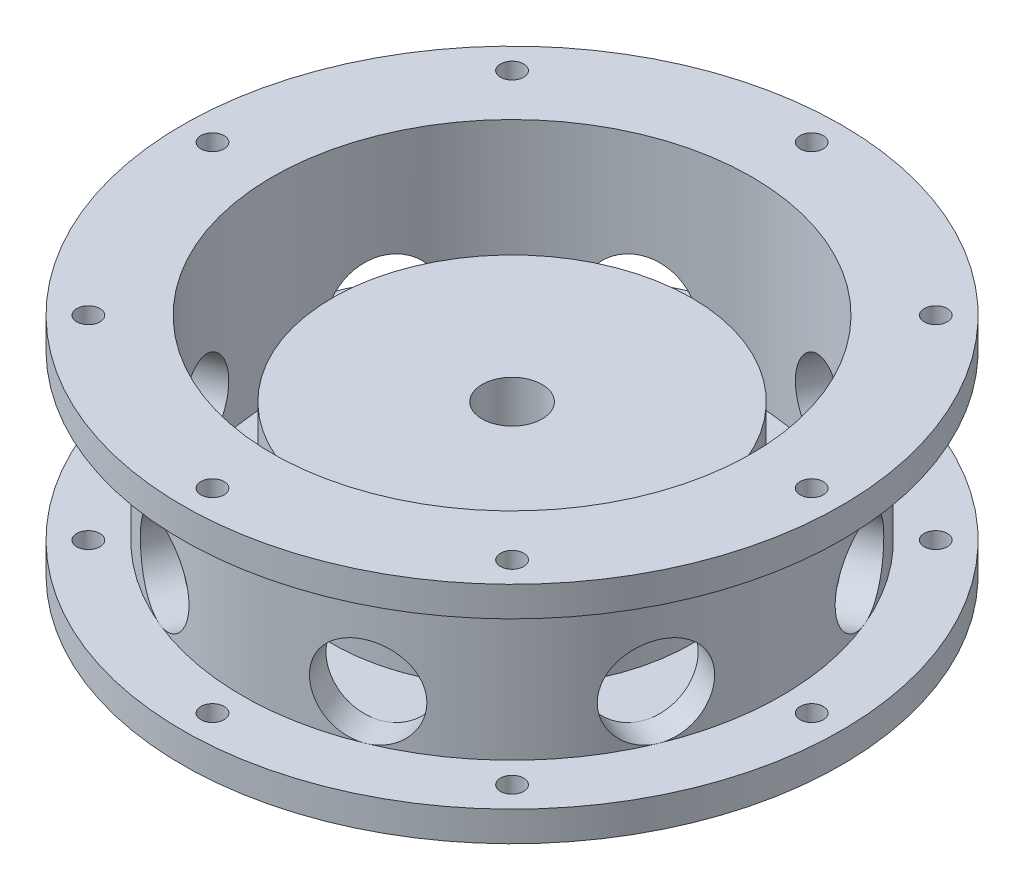
from build123d import *

# Parameters (mm, degrees)
F_10_0_1935_DIAMETER_HOLE2_D = 4.9149
CIRPATTERN1_COUNT            = 8
CUT_EXTRUDE1_REACH           = 162.386
SKETCH5_R                    = 9.525
CIRPATTERN2_COUNT            = 8


with BuildPart() as part:
    # Sketch1 → Revolve1 (revolve)
    with BuildSketch(Plane.XY):
        Polygon((69.85, 0), (6.35, 0), (6.35, 31.75), (38.1, 31.75), (38.1, 6.35), (50.8, 6.35), (50.8, 47.625), (69.85, 47.625), (69.85, 41.275), (57.15, 41.275), (57.15, 6.35), (69.85, 6.35), align=None)
    revolve(axis=Axis((0, 0, 0), (0, 1, 0)))

    # #10 (0.1935) Diameter Hole2 (through all)
    with Locations(Plane(origin=(0, 47.625, 0), x_dir=(1, 0, 0), z_dir=(0, 1, 0))):
        with Locations((0, 63.5)):
            f_10_0_1935_diameter_hole2 = Hole(F_10_0_1935_DIAMETER_HOLE2_D / 2)

    # CirPattern1: #10 (0.1935) Diameter Hole2 ×8 about axis
    cirpattern1_axis = Axis((0, 0, 0), (0, -1, 0))
    for i in range(1, CIRPATTERN1_COUNT):
        add(f_10_0_1935_diameter_hole2.rotate(cirpattern1_axis, i * 360 / CIRPATTERN1_COUNT), mode=Mode.SUBTRACT)

    # Sketch5 → Cut-Extrude1 (cut, up to next)
    with BuildSketch(Plane(origin=(21.87035816, 0, -52.799715283), x_dir=(0, -1, 0), z_dir=(0.3826834323650906, 0, -0.9238795325112865)), mode=Mode.PRIVATE) as cut_extrude1_sk1:
        with Locations((-15.875, 0)):
            Circle(SKETCH5_R)
    cut_extrude1_tool1 = extrude(cut_extrude1_sk1.sketch, amount=-CUT_EXTRUDE1_REACH, mode=Mode.PRIVATE) & part.part
    cut_extrude1 = cut_extrude1_tool1.solids().sort_by_distance((21.870358, 15.875, -52.799715))[0]
    add(cut_extrude1, mode=Mode.SUBTRACT)

    # CirPattern2: Cut-Extrude1 ×8 about axis
    cirpattern2_axis = Axis((0, 0, 0), (0, -1, 0))
    for i in range(1, CIRPATTERN2_COUNT):
        add(cut_extrude1.rotate(cirpattern2_axis, i * 360 / CIRPATTERN2_COUNT), mode=Mode.SUBTRACT)


solid = part.part
